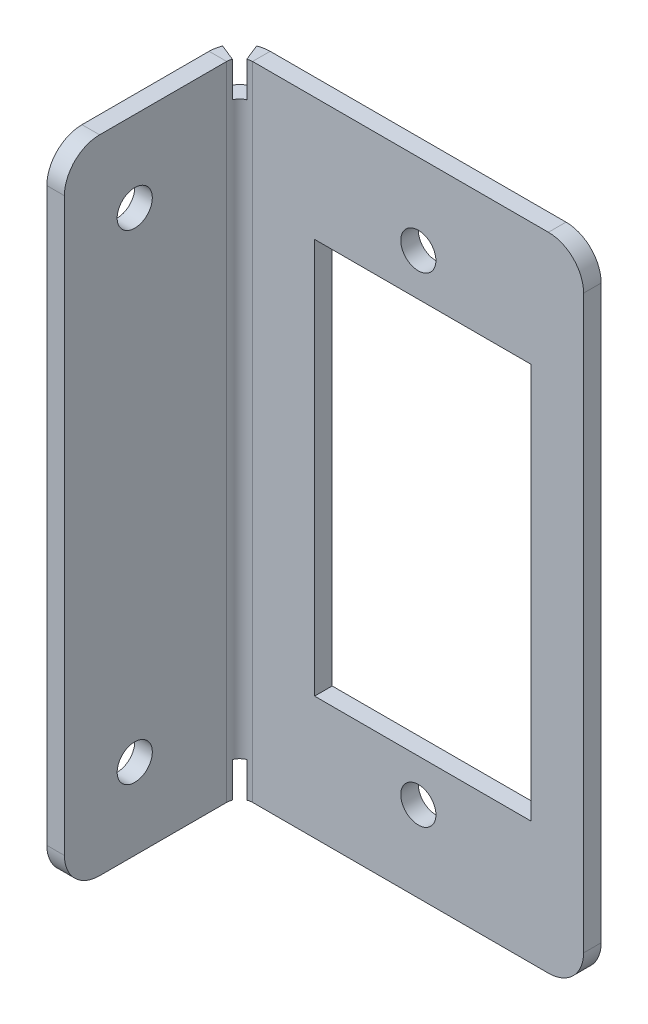
from build123d import *

# Parameters (mm, degrees)
MODEL_R                         = 1
MODEL_W                         = 12.3
MODEL_H                         = 22.500175579
BRIDA_BASE1_DEPTH               = 1
PLIEGUE_START                   = -94.948568727
PLIEGUE_CROQUIZADO1_DEPTH       = 36.500175579
PLIEGUE_CROQUIZADO1_2_DEPTH     = 2
PLIEGUE_START_2                 = -60.448393148
PLIEGUE_CROQUIZADO1_3_DEPTH     = 2
PLIEGUE_CROQUIZADO1_4_DEPTH     = 36.500175579
PLIEGUE_START_3                 = -92.948568727
PLIEGUE_CROQUIZADO1_5_DEPTH     = 32.500175579
PLIEGUE_START_4                 = 176.99991226
PLIEGUE_CROQUIZADO1_6_OUTLINE_R = 1
PLIEGUE_CROQUIZADO1_6_DEPTH     = 1


with BuildPart() as part:
    # Brida base1: sheet metal written as solids
    # Model → Brida base1 (new body)
    with BuildSketch(Plane.XY):
        with BuildLine():
            Line((178.265288891, -94.948568727), (178.265288891, -92.948568727))
            Line((178.265288891, -92.948568727), (177.265288891, -92.948568727))
            Line((177.265288891, -92.948568727), (177.265288891, -94.948568727))
            Line((177.265288891, -94.948568727), (169.565288891, -94.948568727))
            ThreePointArc((169.565288891, -94.948568727), (168.151075328, -94.362782289), (167.565288891, -92.948568727))
            Line((167.565288891, -92.948568727), (167.565288891, -60.448393148))
            ThreePointArc((167.565288891, -60.448393148), (168.151075328, -59.034179585), (169.565288891, -58.448393148))
            Line((169.565288891, -58.448393148), (177.265288891, -58.448393148))
            Line((177.265288891, -58.448393148), (177.265288891, -60.448393148))
            Line((177.265288891, -60.448393148), (178.265288891, -60.448393148))
            Line((178.265288891, -60.448393148), (178.265288891, -58.448393148))
            Line((178.265288891, -58.448393148), (195.565288891, -58.448393148))
            ThreePointArc((195.565288891, -58.448393148), (196.979502453, -59.034179585), (197.565288891, -60.448393148))
            Line((197.565288891, -60.448393148), (197.565288891, -92.948568727))
            ThreePointArc((197.565288891, -92.948568727), (196.979502453, -94.362782289), (195.565288891, -94.948568727))
            Line((195.565288891, -94.948568727), (178.265288891, -94.948568727))
        make_face()
        with Locations((171.565288891, -90.348568727)):
            Circle(MODEL_R, mode=Mode.SUBTRACT)
        with Locations((171.565288891, -63.048393148)):
            Circle(MODEL_R, mode=Mode.SUBTRACT)
        with Locations((188.165288891, -63.048393148)):
            Circle(MODEL_R, mode=Mode.SUBTRACT)
        with Locations((188.165288891, -90.348568727)):
            Circle(MODEL_R, mode=Mode.SUBTRACT)
        with Locations((188.415288891, -76.698480938)):
            Rectangle(MODEL_W, MODEL_H, mode=Mode.SUBTRACT)
    extrude(amount=-BRIDA_BASE1_DEPTH)

    # Pliegue croquizado1: read off the stored shape, not the designer's step
    # Pliegue croquizado1 outline → Pliegue croquizado1 (cut)
    with BuildSketch(Plane(origin=(0, 0, 0), x_dir=(1, 0, 0), z_dir=(0, 1, 0)).offset(PLIEGUE_START)):
        with BuildLine():
            Line((167.565288891, 0), (177.163871169, 0))
            ThreePointArc((177.163871169, 0), (177.804686096, 0.728828115), (178.73651226, 1))
            Line((178.73651226, 1), (167.565288891, 1))
            Line((167.565288891, 1), (167.565288891, 0))
        make_face()
    extrude(amount=PLIEGUE_CROQUIZADO1_DEPTH, mode=Mode.SUBTRACT)

    # Pliegue croquizado1 2 outline → Pliegue croquizado1 2 (cut)
    with BuildSketch(Plane(origin=(0, 0, 0), x_dir=(1, 0, 0), z_dir=(0, 1, 0)).offset(PLIEGUE_START)):
        with BuildLine():
            ThreePointArc((177.265288891, 0.186049099), (177.211739726, 0.094572835), (177.163871169, 0))
            Line((177.163871169, 0), (177.265288891, 0))
            Line((177.265288891, 0), (177.265288891, 0.186049099))
        make_face()
        Polygon((178.265288891, 0), (178.441395947, 0), (178.265288891, 0.439557056), align=None)
    extrude(amount=PLIEGUE_CROQUIZADO1_2_DEPTH, mode=Mode.SUBTRACT)

    # Pliegue croquizado1 3 outline → Pliegue croquizado1 3 (cut)
    with BuildSketch(Plane(origin=(0, 0, 0), x_dir=(1, 0, 0), z_dir=(0, 1, 0)).offset(PLIEGUE_START_2)):
        with BuildLine():
            ThreePointArc((177.265288891, 0.186049099), (177.211739726, 0.094572835), (177.163871169, 0))
            Line((177.163871169, 0), (177.265288891, 0))
            Line((177.265288891, 0), (177.265288891, 0.186049099))
        make_face()
        Polygon((178.265288891, 0), (178.441395947, 0), (178.265288891, 0.439557056), align=None)
    extrude(amount=PLIEGUE_CROQUIZADO1_3_DEPTH, mode=Mode.SUBTRACT)

    # Pliegue croquizado1 4 outline → Pliegue croquizado1 4 (add)
    with BuildSketch(Plane(origin=(0, 0, 0), x_dir=(1, 0, 0), z_dir=(0, 1, 0)).offset(PLIEGUE_START)):
        with BuildLine():
            Line((176.99991226, -9.965376631), (177.99991226, -9.965376631))
            Line((177.99991226, -9.965376631), (177.99991226, -0.7366))
            ThreePointArc((177.99991226, -0.7366), (178.01324203, -0.597101848), (178.0527489, -0.46265251))
            Line((178.0527489, -0.46265251), (177.124479337, -0.090744432))
            ThreePointArc((177.124479337, -0.090744432), (177.031338378, -0.407720702), (176.99991226, -0.7366))
            Line((176.99991226, -0.7366), (176.99991226, -9.965376631))
        make_face()
        with BuildLine():
            Line((178.441395947, 0), (178.462564769, -0.05283664))
            ThreePointArc((178.462564769, -0.05283664), (178.597014107, -0.01332977), (178.73651226, 0))
            Line((178.73651226, 0), (178.441395947, 0))
        make_face()
        with BuildLine():
            Line((178.090656691, 0.875432923), (178.265288891, 0.439557056))
            Line((178.265288891, 0.439557056), (178.265288891, 0.934844913))
            ThreePointArc((178.265288891, 0.934844913), (178.17718339, 0.907459237), (178.090656691, 0.875432923))
        make_face()
    extrude(amount=PLIEGUE_CROQUIZADO1_4_DEPTH)

    # Pliegue croquizado1 5 outline → Pliegue croquizado1 5 (add)
    with BuildSketch(Plane(origin=(0, 0, 0), x_dir=(1, 0, 0), z_dir=(0, 1, 0)).offset(PLIEGUE_START_3)):
        with BuildLine():
            Line((177.124479337, -0.090744432), (178.0527489, -0.46265251))
            ThreePointArc((178.0527489, -0.46265251), (178.215657405, -0.215745145), (178.462564769, -0.05283664))
            Line((178.462564769, -0.05283664), (178.441395947, 0))
            Line((178.441395947, 0), (177.163871169, 0))
            ThreePointArc((177.163871169, 0), (177.143528964, -0.045091664), (177.124479337, -0.090744432))
        make_face()
    extrude(amount=PLIEGUE_CROQUIZADO1_5_DEPTH)

    # Pliegue croquizado1 6 outline → Pliegue croquizado1 6 (cut)
    with BuildSketch(Plane.YZ.offset(PLIEGUE_START_4)):
        with BuildLine():
            Line((-58.448393148, 9.965376631), (-60.448393148, 9.965376631))
            ThreePointArc((-60.448393148, 9.965376631), (-59.034179585, 9.379590194), (-58.448393148, 7.965376631))
            Line((-58.448393148, 7.965376631), (-58.448393148, 9.965376631))
        make_face()
        with BuildLine():
            ThreePointArc((-94.948568727, 7.965376631), (-94.362782289, 9.379590194), (-92.948568727, 9.965376631))
            Line((-92.948568727, 9.965376631), (-94.948568727, 9.965376631))
            Line((-94.948568727, 9.965376631), (-94.948568727, 7.965376631))
        make_face()
        with Locations((-90.348568727, 5.965376631)):
            Circle(PLIEGUE_CROQUIZADO1_6_OUTLINE_R)
        with Locations((-63.048393148, 5.965376631)):
            Circle(PLIEGUE_CROQUIZADO1_6_OUTLINE_R)
    extrude(amount=PLIEGUE_CROQUIZADO1_6_DEPTH, mode=Mode.SUBTRACT)


solid = part.part
